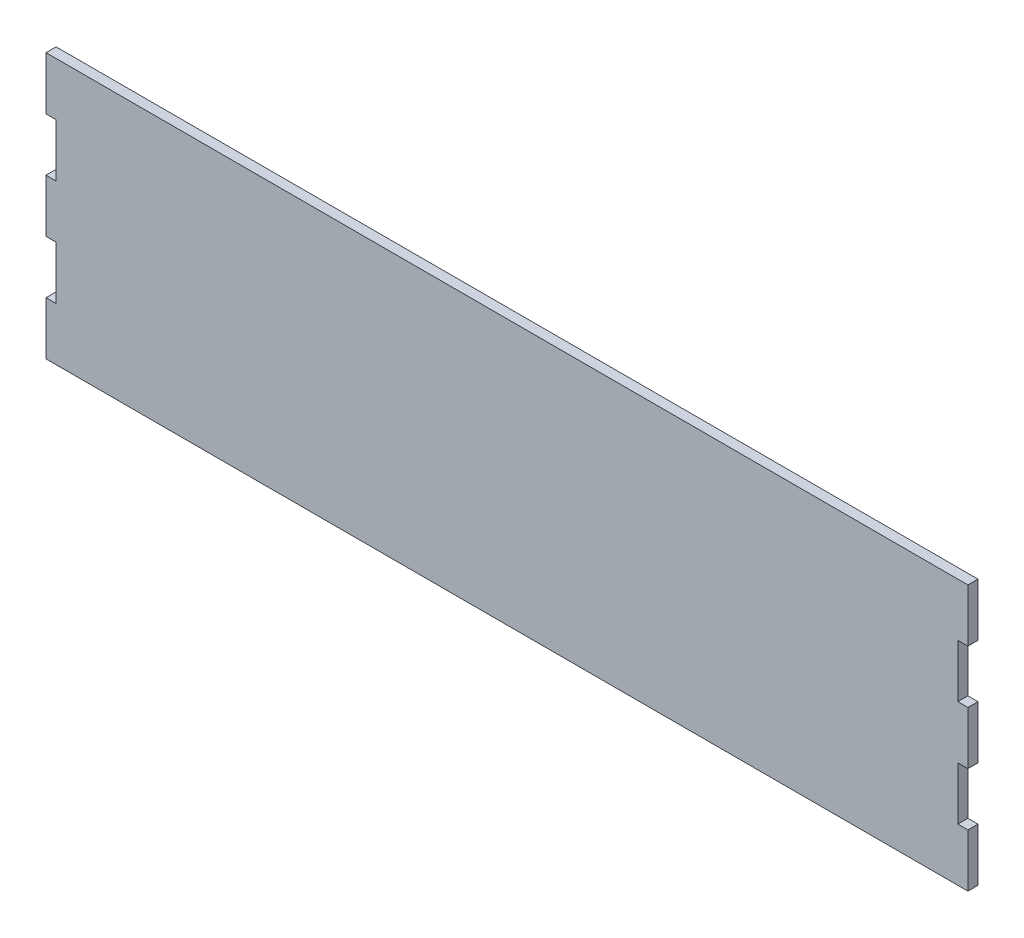
from build123d import *

# Parameters (mm, degrees)
BOSS_EXTRUDE1_DEPTH = 4.826


with BuildPart() as part:
    # Sketch1 → Boss-Extrude1 (new body)
    with BuildSketch(Plane.XY):
        Polygon((95.25, 50.8), (95.25, 25.4), (90.424, 25.4), (90.424, 0), (95.25, 0), (527.05, 0), (531.876, 0), (531.876, 25.4), (527.05, 25.4), (527.05, 50.8), (531.876, 50.8), (531.876, 76.2), (527.05, 76.2), (527.05, 101.6), (531.876, 101.6), (531.876, 127), (90.424, 127), (90.424, 101.6), (95.25, 101.6), (95.25, 76.2), (90.424, 76.2), (90.424, 50.8), align=None)
    extrude(amount=BOSS_EXTRUDE1_DEPTH)


solid = part.part
